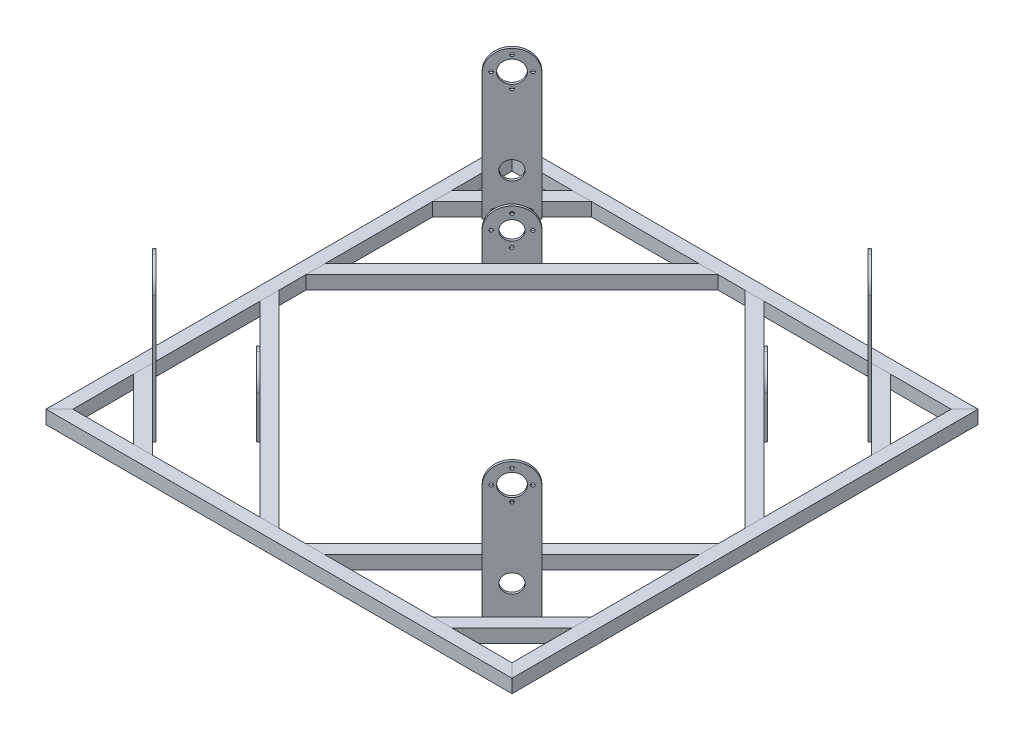
from build123d import *

# Parameters (mm, degrees)
PROFILE_BASE_DEPTH        = 574.993929628
PROFILE_BASE_DEPTH_BACK   = 23.450640303
SKETCH12_W                = 15.875
SKETCH12_H                = 15.875
SKETCH12_W_2              = 11.875
SKETCH12_H_2              = 11.875
SKETCH12_ON_SEGMENT_2_W   = 15.875
SKETCH12_ON_SEGMENT_2_H   = 15.875
SKETCH12_ON_SEGMENT_2_W_2 = 11.875
SKETCH12_ON_SEGMENT_2_H_2 = 11.875
PROFILE_BASE_2_DEPTH      = 598.444569931
SKETCH12_ON_SEGMENT_3_W   = 15.875
SKETCH12_ON_SEGMENT_3_H   = 15.875
SKETCH12_ON_SEGMENT_3_W_2 = 11.875
SKETCH12_ON_SEGMENT_3_H_2 = 11.875
PROFILE_BASE_3_DEPTH      = 598.444569931
SKETCH12_ON_SEGMENT_4_W   = 15.875
SKETCH12_ON_SEGMENT_4_H   = 15.875
SKETCH12_ON_SEGMENT_4_W_2 = 11.875
SKETCH12_ON_SEGMENT_4_H_2 = 11.875
PROFILE_BASE_4_DEPTH      = 598.444569931
SKETCH12_ON_SEGMENT_5_W   = 15.875
SKETCH12_ON_SEGMENT_5_H   = 15.875
SKETCH12_ON_SEGMENT_5_W_2 = 11.875
SKETCH12_ON_SEGMENT_5_H_2 = 11.875
PROFILE_BASE_5_DEPTH      = 224.901280605
SKETCH12_ON_SEGMENT_6_W   = 15.875
SKETCH12_ON_SEGMENT_6_H   = 15.875
SKETCH12_ON_SEGMENT_6_W_2 = 11.875
SKETCH12_ON_SEGMENT_6_H_2 = 11.875
PROFILE_BASE_6_DEPTH      = 436.901280605
SKETCH14_W                = 50
SKETCH14_H                = 175
SKETCH14_R                = 12.95
SKETCH14_R_2              = 2
SKETCH14_R_3              = 3
SKETCH14_R_4              = 11
LONG_OMNI_MOUNT_DEPTH     = 3
SKETCH15_W                = 50
SKETCH15_H                = 75
SKETCH15_R                = 11
SKETCH15_R_2              = 2
SKETCH15_R_3              = 3
SHORT_OMNI_MOUNT_DEPTH    = 3
FILLET_SHORT_OMNI_MOUNT_R = 25
FILLET1_R                 = 25
CIRPATTERN1_COUNT         = 4


with BuildPart() as part:
    # Sketch12 → profile_base (new, two sides: drawn at the far end of the back side and taken through both)
    with BuildSketch(Plane(origin=(-267.834144663, 7.9375, -275.771644663), x_dir=(1, 0, 0), z_dir=(0, 0, 1)).offset(-PROFILE_BASE_DEPTH_BACK)):
        Rectangle(SKETCH12_W, SKETCH12_H)
        Rectangle(SKETCH12_W_2, SKETCH12_H_2, mode=Mode.SUBTRACT)
    extrude(amount=PROFILE_BASE_DEPTH + PROFILE_BASE_DEPTH_BACK)

    # profile_base mitre 1
    split(bisect_by=Plane(origin=(-275.771644663, 0, -275.771644663), x_dir=(0, -1, 0), z_dir=(-0.707106781, 0, 0.707106781)), keep=Keep.TOP)

    # profile_base mitre 2
    split(bisect_by=Plane(origin=(-275.771644663, 0, 275.771644663), x_dir=(0, -1, 0), z_dir=(-0.707106781, 0, -0.707106781)), keep=Keep.TOP)


with BuildPart() as body_2:
    # Sketch12 on segment 2 (carried to segment 2) → profile_base 2 (new body)
    with BuildSketch(Plane(origin=(-299.222284965, 7.9375, 267.834144663), x_dir=(0, 0, -1), z_dir=(1, 0, 0))):
        Rectangle(SKETCH12_ON_SEGMENT_2_W, SKETCH12_ON_SEGMENT_2_H)
        Rectangle(SKETCH12_ON_SEGMENT_2_W_2, SKETCH12_ON_SEGMENT_2_H_2, mode=Mode.SUBTRACT)
    extrude(amount=PROFILE_BASE_2_DEPTH)

    # profile_base 2 mitre 1
    split(bisect_by=Plane(origin=(-275.771644663, 0, 275.771644663), x_dir=(0, 1, 0), z_dir=(0.707106781, 0, 0.707106781)), keep=Keep.TOP)

    # profile_base 2 mitre 2
    split(bisect_by=Plane(origin=(275.771644663, 0, 275.771644663), x_dir=(0, -1, 0), z_dir=(-0.707106781, 0, 0.707106781)), keep=Keep.TOP)


with BuildPart() as body_3:
    # Sketch12 on segment 3 (carried to segment 3) → profile_base 3 (new body)
    with BuildSketch(Plane(origin=(267.834144663, 7.9375, 299.222284965), x_dir=(-1, 0, 0), z_dir=(0, 0, -1))):
        Rectangle(SKETCH12_ON_SEGMENT_3_W, SKETCH12_ON_SEGMENT_3_H)
        Rectangle(SKETCH12_ON_SEGMENT_3_W_2, SKETCH12_ON_SEGMENT_3_H_2, mode=Mode.SUBTRACT)
    extrude(amount=PROFILE_BASE_3_DEPTH)

    # profile_base 3 mitre 1
    split(bisect_by=Plane(origin=(275.771644663, 0, -275.771644663), x_dir=(0, 1, 0), z_dir=(0.707106781, 0, 0.707106781)), keep=Keep.TOP)

    # profile_base 3 mitre 2
    split(bisect_by=Plane(origin=(275.771644663, 0, 275.771644663), x_dir=(0, 1, 0), z_dir=(0.707106781, 0, -0.707106781)), keep=Keep.TOP)


with BuildPart() as body_4:
    # Sketch12 on segment 4 (carried to segment 4) → profile_base 4 (new body)
    with BuildSketch(Plane(origin=(299.222284965, 7.9375, -267.834144663), x_dir=(0, 0, 1), z_dir=(-1, 0, 0))):
        Rectangle(SKETCH12_ON_SEGMENT_4_W, SKETCH12_ON_SEGMENT_4_H)
        Rectangle(SKETCH12_ON_SEGMENT_4_W_2, SKETCH12_ON_SEGMENT_4_H_2, mode=Mode.SUBTRACT)
    extrude(amount=PROFILE_BASE_4_DEPTH)

    # profile_base 4 mitre 1
    split(bisect_by=Plane(origin=(-275.771644663, 0, -275.771644663), x_dir=(0, 1, 0), z_dir=(0.707106781, 0, -0.707106781)), keep=Keep.TOP)

    # profile_base 4 mitre 2
    split(bisect_by=Plane(origin=(275.771644663, 0, -275.771644663), x_dir=(0, -1, 0), z_dir=(-0.707106781, 0, -0.707106781)), keep=Keep.TOP)


with BuildPart() as body_5:
    # Sketch12 on segment 5 (carried to segment 5) → profile_base 5 (new body)
    with BuildSketch(Plane(origin=(-138.937190906, 7.9375, 297.96641152), x_dir=(-0.707106781, 0, 0.707106781), z_dir=(-0.707106781, 0, -0.707106781))):
        Rectangle(SKETCH12_ON_SEGMENT_5_W, SKETCH12_ON_SEGMENT_5_H)
        Rectangle(SKETCH12_ON_SEGMENT_5_W_2, SKETCH12_ON_SEGMENT_5_H_2, mode=Mode.SUBTRACT)
    extrude(amount=PROFILE_BASE_5_DEPTH)

    # profile_base 5 mitre 1
    split(bisect_by=Plane(origin=(-149.906637612, 0, 259.896644663), x_dir=(0, 1, 0), z_dir=(0, 0, -1)), keep=Keep.TOP)

    # profile_base 5 mitre 2
    split(bisect_by=Plane(origin=(-259.896644663, 0, 149.906637612), x_dir=(0, 1, 0), z_dir=(1, 0, 0)), keep=Keep.TOP)


with BuildPart() as body_6:
    # Sketch12 on segment 6 (carried to segment 6) → profile_base 6 (new body)
    with BuildSketch(Plane(origin=(10.969446706, 7.9375, 297.96641152), x_dir=(-0.707106781, 0, 0.707106781), z_dir=(-0.707106781, 0, -0.707106781))):
        Rectangle(SKETCH12_ON_SEGMENT_6_W, SKETCH12_ON_SEGMENT_6_H)
        Rectangle(SKETCH12_ON_SEGMENT_6_W_2, SKETCH12_ON_SEGMENT_6_H_2, mode=Mode.SUBTRACT)
    extrude(amount=PROFILE_BASE_6_DEPTH)

    # profile_base 6 mitre 1
    split(bisect_by=Plane.YX.offset(-259.896644663), keep=Keep.TOP)

    # profile_base 6 mitre 2
    split(bisect_by=Plane.YZ.offset(-259.896644663), keep=Keep.TOP)


with BuildPart() as body_7:
    # Sketch14 → long_omni_mount (new body)
    with BuildSketch(Plane(origin=(-212.839141137, 0, 212.839141137), x_dir=(-0.7071067811865511, 1.1738577838137186e-15, -0.7071067811865439), z_dir=(0.7071067811865439, -2.1906067914926835e-15, -0.7071067811865511))):
        with Locations((0, 87.5)):
            Rectangle(SKETCH14_W, SKETCH14_H)
        with Locations((0, 151)):
            Circle(SKETCH14_R, mode=Mode.SUBTRACT)
        with Locations((0, 168.46)):
            Circle(SKETCH14_R_2, mode=Mode.SUBTRACT)
        with Locations((17.46, 151)):
            Circle(SKETCH14_R_2, mode=Mode.SUBTRACT)
        with Locations((0, 133.54)):
            Circle(SKETCH14_R_2, mode=Mode.SUBTRACT)
        with Locations((-17.46, 151)):
            Circle(SKETCH14_R_2, mode=Mode.SUBTRACT)
        with Locations((0, 7.9375)):
            Circle(SKETCH14_R_3, mode=Mode.SUBTRACT)
        with Locations((15, 7.9375)):
            Circle(SKETCH14_R_3, mode=Mode.SUBTRACT)
        with Locations((-15, 7.9375)):
            Circle(SKETCH14_R_3, mode=Mode.SUBTRACT)
        with Locations((0, 50)):
            Circle(SKETCH14_R_4, mode=Mode.SUBTRACT)
    extrude(amount=LONG_OMNI_MOUNT_DEPTH)

    # Fillet1
    fillet1_edges = [body_7.edges().sort_by_distance(p)[0] for p in [
        (-229.456150495, 175, 194.100811436),
        (-194.100811436, 175, 229.456150495),
    ]]
    fillet(fillet1_edges, radius=FILLET1_R - 0.0001)  # a hair under: the kernel refuses the full size


with BuildPart() as body_8:
    # Sketch15 → short_omni_mount (new body)
    with BuildSketch(Plane(origin=(-149.111142483, 0, 149.111142483), x_dir=(0.7071067811865513, -1.1738577838137205e-15, 0.7071067811865438), z_dir=(-0.7071067811865438, 2.1906067914926835e-15, 0.7071067811865513))):
        with Locations((0, 37.5)):
            Rectangle(SKETCH15_W, SKETCH15_H)
        with Locations((0, 50)):
            Circle(SKETCH15_R, mode=Mode.SUBTRACT)
        with Locations((0, 67.46)):
            Circle(SKETCH15_R_2, mode=Mode.SUBTRACT)
        with Locations((0, 7.9375)):
            Circle(SKETCH15_R_3, mode=Mode.SUBTRACT)
        with Locations((15, 7.9375)):
            Circle(SKETCH15_R_3, mode=Mode.SUBTRACT)
        with Locations((-15, 7.9375)):
            Circle(SKETCH15_R_3, mode=Mode.SUBTRACT)
        with Locations((17.479086882, 50.116975333)):
            Circle(SKETCH15_R_2, mode=Mode.SUBTRACT)
        with Locations((0.136062214, 32.637888451)):
            Circle(SKETCH15_R_2, mode=Mode.SUBTRACT)
        with Locations((-17.343024667, 49.980913118)):
            Circle(SKETCH15_R_2, mode=Mode.SUBTRACT)
    extrude(amount=SHORT_OMNI_MOUNT_DEPTH)

    # fillet_short_omni_mount
    fillet_short_omni_mount_edges = [body_8.edges().sort_by_distance(p)[0] for p in [
        (-132.494133125, 75, 167.849472184),
        (-167.849472184, 75, 132.494133125),
    ]]
    fillet(fillet_short_omni_mount_edges, radius=FILLET_SHORT_OMNI_MOUNT_R - 0.0001)  # a hair under: the kernel refuses the full size


with BuildPart() as cirpattern1_1:
    # CirPattern1: pattern copy
    add(body_8.part.rotate(Axis((0, 0, 0), (0, 1, 0)), 1 * 360 / CIRPATTERN1_COUNT))


with BuildPart() as cirpattern1_2:
    # CirPattern1: pattern copy
    add(body_8.part.rotate(Axis((0, 0, 0), (0, 1, 0)), 2 * 360 / CIRPATTERN1_COUNT))


with BuildPart() as cirpattern1_3:
    # CirPattern1: pattern copy
    add(body_8.part.rotate(Axis((0, 0, 0), (0, 1, 0)), 3 * 360 / CIRPATTERN1_COUNT))


with BuildPart() as cirpattern1_4:
    # CirPattern1: pattern copy
    add(body_7.part.rotate(Axis((0, 0, 0), (0, 1, 0)), 1 * 360 / CIRPATTERN1_COUNT))


with BuildPart() as cirpattern1_5:
    # CirPattern1: pattern copy
    add(body_7.part.rotate(Axis((0, 0, 0), (0, 1, 0)), 2 * 360 / CIRPATTERN1_COUNT))


with BuildPart() as cirpattern1_6:
    # CirPattern1: pattern copy
    add(body_7.part.rotate(Axis((0, 0, 0), (0, 1, 0)), 3 * 360 / CIRPATTERN1_COUNT))


with BuildPart() as cirpattern1_7:
    # CirPattern1: pattern copy
    add(body_5.part.rotate(Axis((0, 0, 0), (0, 1, 0)), 1 * 360 / CIRPATTERN1_COUNT))


with BuildPart() as cirpattern1_8:
    # CirPattern1: pattern copy
    add(body_5.part.rotate(Axis((0, 0, 0), (0, 1, 0)), 2 * 360 / CIRPATTERN1_COUNT))


with BuildPart() as cirpattern1_9:
    # CirPattern1: pattern copy
    add(body_5.part.rotate(Axis((0, 0, 0), (0, 1, 0)), 3 * 360 / CIRPATTERN1_COUNT))


with BuildPart() as cirpattern1_10:
    # CirPattern1: pattern copy
    add(body_6.part.rotate(Axis((0, 0, 0), (0, 1, 0)), 1 * 360 / CIRPATTERN1_COUNT))


with BuildPart() as cirpattern1_11:
    # CirPattern1: pattern copy
    add(body_6.part.rotate(Axis((0, 0, 0), (0, 1, 0)), 2 * 360 / CIRPATTERN1_COUNT))


with BuildPart() as cirpattern1_12:
    # CirPattern1: pattern copy
    add(body_6.part.rotate(Axis((0, 0, 0), (0, 1, 0)), 3 * 360 / CIRPATTERN1_COUNT))


solid = Compound([part.part, body_2.part, body_3.part, body_4.part, body_5.part, body_6.part, body_7.part, body_8.part, cirpattern1_1.part, cirpattern1_2.part, cirpattern1_3.part, cirpattern1_4.part, cirpattern1_5.part, cirpattern1_6.part, cirpattern1_7.part, cirpattern1_8.part, cirpattern1_9.part, cirpattern1_10.part, cirpattern1_11.part, cirpattern1_12.part])
